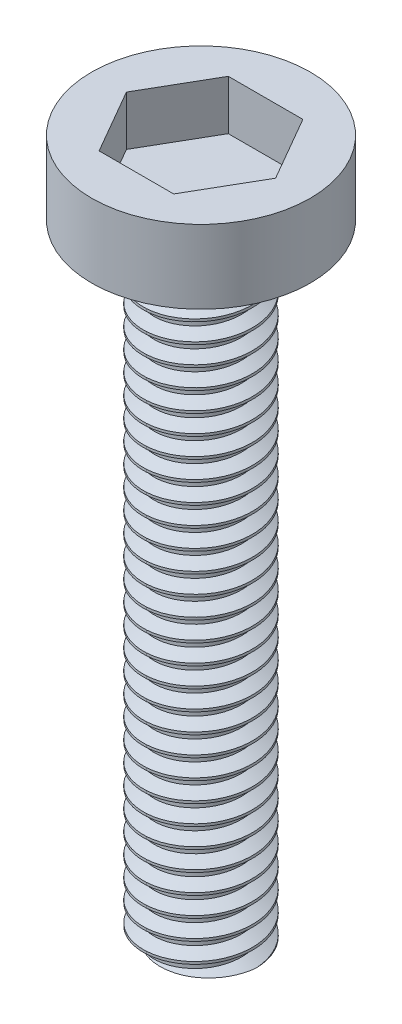
from build123d import *

# Parameters (mm, degrees)
CROQUIS1_R              = 5.5
SALIENTE_EXTRUIR1_DEPTH = 3.7
CROQUIS2_R              = 2.75
SALIENTE_EXTRUIR2_DEPTH = 31.23
CORTAR_EXTRUIR1_DEPTH   = 2.5
ROSCA1_PITCH            = 1


with BuildPart() as part:
    # Croquis1 → Saliente-Extruir1 (new body)
    with BuildSketch(Plane(origin=(0, 0, 0), x_dir=(1, 0, 0), z_dir=(0, 1, 0))):
        with Locations(Location((0, 0, 0), (0, 0, 270))):
            Circle(CROQUIS1_R)
    extrude(amount=SALIENTE_EXTRUIR1_DEPTH)

    # Croquis2 → Saliente-Extruir2 (add)
    with BuildSketch(Plane(origin=(0, 0, 0), x_dir=(1, 0, 0), z_dir=(0, 1, 0))):
        with Locations(Location((0, 0, 0), (0, 0, 270))):
            Circle(CROQUIS2_R)
    extrude(amount=-SALIENTE_EXTRUIR2_DEPTH)

    # Croquis4 → Cortar-Extruir1 (cut)
    with BuildSketch(Plane(origin=(0, 3.7, 0), x_dir=(1, 0, 0), z_dir=(0, 1, 0))):
        Polygon((3.75277675, 0), (1.876388375, 3.25), (-1.876388375, 3.25), (-3.75277675, 0), (-1.876388375, -3.25), (1.876388375, -3.25), align=None)
    extrude(amount=-CORTAR_EXTRUIR1_DEPTH, mode=Mode.SUBTRACT)

    # Rosca1: arcs per turn and ends read off the stored shape
    # Rosca1: the profile of Perfil de rosca1 profile screwed along a right-hand helix through 31.23 turns, 8 arcs to a turn; built about Z, then put on its axis
    rosca1_z = Axis((0, 0, 0), (0, 0, 1))
    rosca1_corners = [(2.7503, 1e-09, -0.000173205), (2.7503, 1e-09, 0.875173202), (2.208734125, 1e-09, 0.562499999), (2.208734125, 1e-09, 0.312499999)]
    with BuildLine(mode=Mode.PRIVATE) as rosca1_profile:
        Line(rosca1_corners[0], rosca1_corners[1])
        Line(rosca1_corners[1], rosca1_corners[2])
        Line(rosca1_corners[2], rosca1_corners[3])
        Line(rosca1_corners[3], rosca1_corners[0])
    rosca1_cap = Face(rosca1_profile.wire())
    rosca1_turn_angles = [0, 22.5, 45, 67.5, 90, 112.5, 135, 157.5, 180, 202.5, 225, 247.5, 270, 292.5, 315, 337.5, 360]
    rosca1_turn_weights = [1, 0.9238795325112867, 1, 0.9238795325112867, 1, 0.9238795325112867, 1, 0.9238795325112867, 1, 0.9238795325112867, 1, 0.9238795325112867, 1, 0.9238795325112867, 1, 0.9238795325112867, 1]
    rosca1_turn_rails = [Edge.make_bspline([Vector(p[0], p[1], 0).rotate(rosca1_z, rosca1_turn_angles[k]) / rosca1_turn_weights[k] + Vector(0, 0, p[2] + ROSCA1_PITCH * rosca1_turn_angles[k] / 360) for k in range(17)], [0, 0, 0, 1, 1, 2, 2, 3, 3, 4, 4, 5, 5, 6, 6, 7, 7, 8, 8, 8], 2, rosca1_turn_weights) for p in rosca1_corners]
    rosca1_turn_sides = [Face.make_surface_from_curves(rosca1_turn_rails[p[0]], rosca1_turn_rails[p[1]]) for p in [(0, 1), (1, 2), (2, 3), (3, 0)]]
    rosca1_last_angles = [11160, 11182.5, 11205, 11223.9, 11242.8]
    rosca1_last_weights = [1, 0.9238795325112867, 1, 0.9460853588275216, 1]
    rosca1_last_rails = [Edge.make_bspline([Vector(p[0], p[1], 0).rotate(rosca1_z, rosca1_last_angles[k]) / rosca1_last_weights[k] + Vector(0, 0, p[2] + ROSCA1_PITCH * rosca1_last_angles[k] / 360) for k in range(5)], [0, 0, 0, 1, 1, 2, 2, 2], 2, rosca1_last_weights) for p in rosca1_corners]
    rosca1_last_sides = [Face.make_surface_from_curves(rosca1_last_rails[p[0]], rosca1_last_rails[p[1]]) for p in [(0, 1), (1, 2), (2, 3), (3, 0)]]
    rosca1 = Plane(origin=(0, -32.23, 0), x_dir=(0.999847695, 0, -0.017452406), z_dir=(0, 1, 0)) * Solid(Shell([*[p.moved(Location((0, 0, ROSCA1_PITCH * i))) for i in range(31) for p in rosca1_turn_sides], *rosca1_last_sides, rosca1_cap, rosca1_cap.rotate(rosca1_z, 11242.8).moved(Location((0, 0, ROSCA1_PITCH * 11242.8 / 360)))]))
    add(rosca1, mode=Mode.SUBTRACT)


solid = part.part
